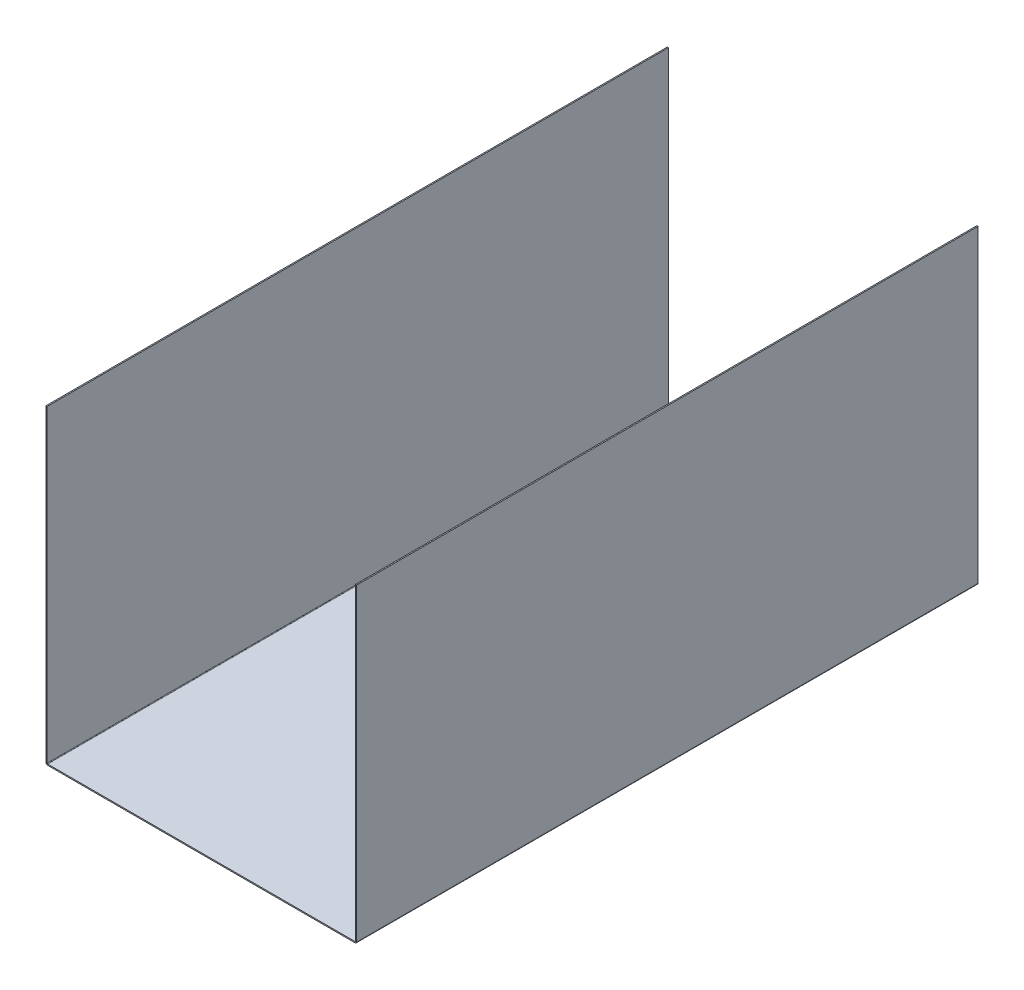
from build123d import *

# Parameters (mm, degrees)
BASE_FLANGE1_DEPTH = 400


# Sheet-metal steps are written as plain solids
with BuildPart() as part:
    # Sketch1 → Base-Flange1 (new, symmetric)
    with BuildSketch(Plane.XY):
        with BuildLine():
            Line((-200, 400), (-200, 2.2))
            ThreePointArc((-200, 2.2), (-199.355634919, 0.644365081), (-197.8, 0))
            Line((-197.8, 0), (197.8, 0))
            ThreePointArc((197.8, 0), (199.355634919, 0.644365081), (200, 2.2))
            Line((200, 2.2), (200, 400))
            Line((200, 400), (198.5, 400))
            Line((198.5, 400), (198.5, 2.2))
            ThreePointArc((198.5, 2.2), (198.294974747, 1.705025253), (197.8, 1.5))
            Line((197.8, 1.5), (-197.8, 1.5))
            ThreePointArc((-197.8, 1.5), (-198.294974747, 1.705025253), (-198.5, 2.2))
            Line((-198.5, 2.2), (-198.5, 400))
            Line((-198.5, 400), (-200, 400))
        make_face()
    extrude(amount=BASE_FLANGE1_DEPTH, both=True)


solid = part.part
